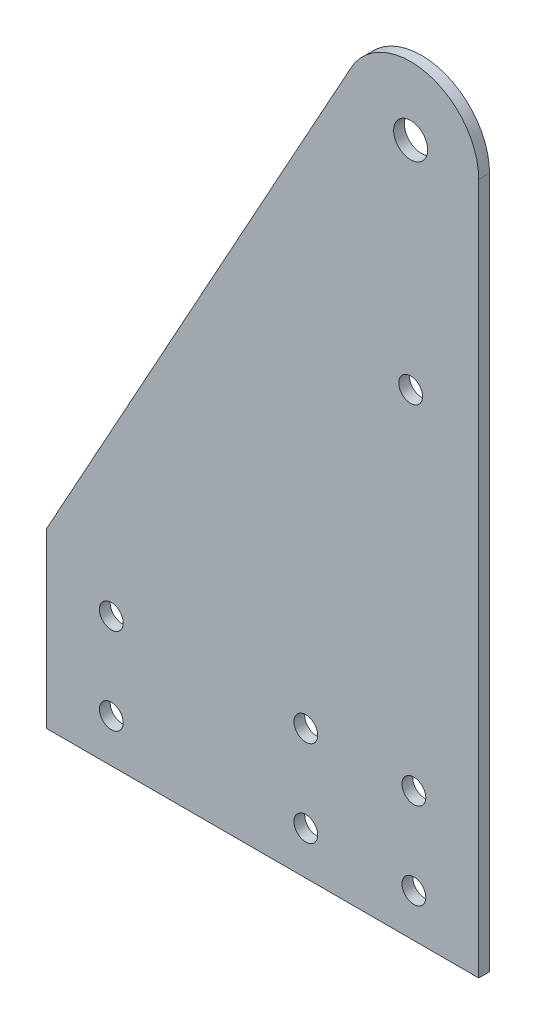
from build123d import *

# Parameters (mm, degrees)
SKETCH1_R           = 5
SKETCH1_R_2         = 3.5
BOSS_EXTRUDE1_DEPTH = 3.175


with BuildPart() as part:
    # Sketch1 → Boss-Extrude1 (new body)
    with BuildSketch(Plane.XY):
        with BuildLine():
            Line((-63.5, -25.4), (63.5, -25.4))
            Line((63.5, -25.4), (63.5, 177.8))
            ThreePointArc((63.5, 177.8), (48.491876086, 197.167012499), (25.991882686, 187.467772655))
            Line((25.991882686, 187.467772655), (-63.5, 25.4))
            Line((-63.5, 25.4), (-63.5, -25.4))
        make_face()
        with Locations((43.5, 177.8)):
            Circle(SKETCH1_R, mode=Mode.SUBTRACT)
        with Locations((-44.45, 12.7)):
            Circle(SKETCH1_R_2, mode=Mode.SUBTRACT)
        with Locations((44.45, 12.7)):
            Circle(SKETCH1_R_2, mode=Mode.SUBTRACT)
        with Locations((44.45, -12.7)):
            Circle(SKETCH1_R_2, mode=Mode.SUBTRACT)
        with Locations((-44.45, -12.7)):
            Circle(SKETCH1_R_2, mode=Mode.SUBTRACT)
        with Locations((12.7, 12.7)):
            Circle(SKETCH1_R_2, mode=Mode.SUBTRACT)
        with Locations((12.7, -12.7)):
            Circle(SKETCH1_R_2, mode=Mode.SUBTRACT)
        with Locations((43.5, 114.3)):
            Circle(SKETCH1_R_2, mode=Mode.SUBTRACT)
    extrude(amount=BOSS_EXTRUDE1_DEPTH)


solid = part.part
